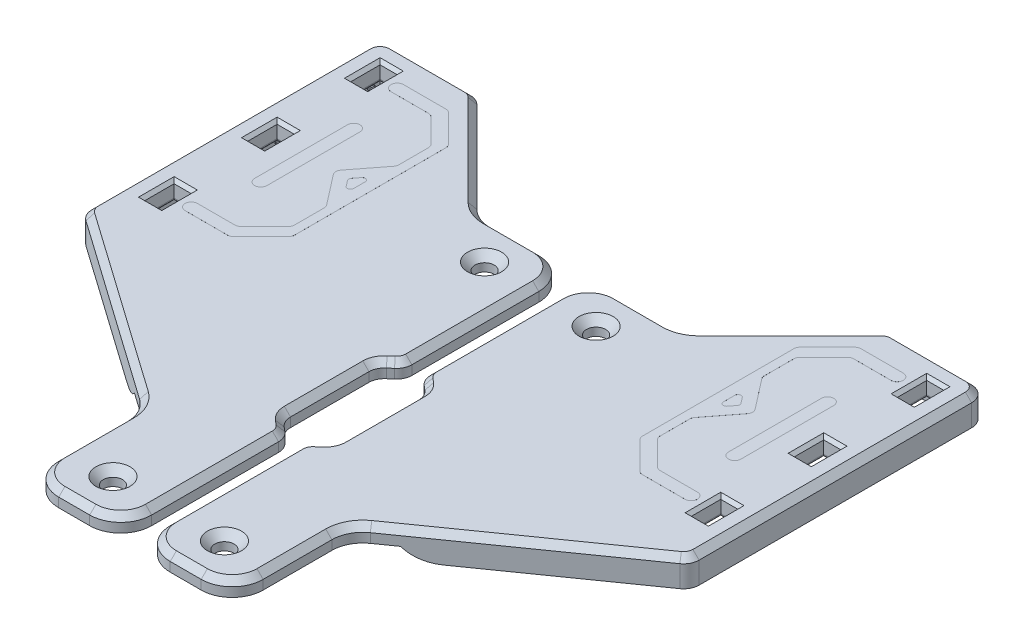
from build123d import *

# Parameters (mm, degrees)
SKETCH_1_R                  = 3.0999999999999996
SKETCH_1_R_2                = 3.099999999999995
EXTRUDE_1_DEPTH             = 6
EXTRUDE_START               = -3
SKETCH_1_3_R                = 3.0999999999999996
SKETCH_1_3_R_2              = 3.099999999999995
EXTRUDE_2_DEPTH             = 3
CUT_EXTRUDE_1_REACH         = 135.137
CUT_EXTRUDE_2_DEPTH         = 3
CHAMFER_2_SIZE              = 1
SKETCH_10_W                 = 2
SKETCH_10_H                 = 0.5
SKETCH_10_H_2               = 0.4999999999999998
SKETCH_10_H_3               = 0.5000000000000002
SKETCH_10_W_2               = 2.000000000000014
EXTRUDE_3_DEPTH             = 0.4
CUT_EXTRUDE_4_DEPTH         = 3.5
CHAMFER_4_SIZE              = 2
EXTRUDE_6_DEPTH             = 0.45
EXTRUDE_START_2             = 0.45
EXTRUDE_7_DEPTH             = 0.45
CUT_EXTRUDE_3_DEPTH         = 0.45
FILLET_5_R                  = 2
FILLET_6_R                  = 1
EXTRUDE_5_DEPTH             = 0.45
FILLET_4_R                  = 1
HOLE_WIZARD_M5_1_AT_2_COUNT = 2
HOLE_WIZARD_M5_1_AT_2_PITCH = 120
CUT_EXTRUDE_5_DEPTH         = 4
FILLET_7_R                  = 10
FILLET_8_R                  = 5
FILLET_9_R                  = 10
CHAMFER_1_SIZE              = 2
FILLET_10_R                 = 2


# Some blends are built 0.0001 mm under size
with BuildPart() as part:
    # 草图1 → 凸台-拉伸1 (new body)
    with BuildSketch(Plane(origin=(0, 0, 0), x_dir=(1, 0, 0), z_dir=(0, 1, 0))):
        Polygon((-15, 72.50000000000001), (15, 72.50000000000001), (14.999999999999998, 19.19549815588643), (9.999999999999996, 15), (9.999999999999996, -15), (15.00000000000001, -19.195498155886444), (15.00000000000001, -72.49999999999999), (-15.00000000000001, -72.49999999999999), (-15.00000000000001, -35.127517333903064), (-79.99999999999999, 10.658211067852571), (-79.99999999999999, 106.25214046456998), (-48.752140464569884, 106.25214046456998), align=None)
        with Locations(Location((0, 60, 0), (0, 0, 270))):
            Circle(SKETCH_1_R, mode=Mode.SUBTRACT)
        with Locations(Location((0, -60.000000000000014, 0), (0, 0, 90))):
            Circle(SKETCH_1_R_2, mode=Mode.SUBTRACT)
    extrude(amount=EXTRUDE_1_DEPTH)

    # 草图1<3> → 凸台-拉伸2 (add)
    with BuildSketch(Plane(origin=(0, 0, 0), x_dir=(1, 0, 0), z_dir=(0, 1, 0)).offset(EXTRUDE_START)):
        Polygon((-15, 72.50000000000001), (15, 72.50000000000001), (14.999999999999998, 19.19549815588643), (9.999999999999996, 15), (9.999999999999996, -15), (15.00000000000001, -19.195498155886444), (15.00000000000001, -72.49999999999999), (-15.00000000000001, -72.49999999999999), (-15.00000000000001, -35.127517333903064), (-79.99999999999999, 10.658211067852571), (-79.99999999999999, 106.25214046456998), (-48.752140464569884, 106.25214046456998), align=None)
        with Locations(Location((0, 60, 0), (0, 0, 270))):
            Circle(SKETCH_1_3_R, mode=Mode.SUBTRACT)
        with Locations(Location((0, -60.000000000000014, 0), (0, 0, 90))):
            Circle(SKETCH_1_3_R_2, mode=Mode.SUBTRACT)
        Polygon((-74.99999999999999, 101.25214046456999), (-74.99999999999997, 21.252140464570747), (-54.99999999999998, 21.252140464570747), (-40.568649385333515, 21.252140464570754), (-14.98918227169708, -10), (7.000000000000009, -10), (7.000000000000009, 10), (-5.513837031563742, 10), (-54.999999999999986, 70.46054475144805), (-54.999999999999986, 101.25214046456998), align=None, mode=Mode.SUBTRACT)
        Polygon((-74.99999999999999, 13.252140464570665), (-74.99999999999999, 18.252140464570754), (-41.989951171353525, 18.25214046457075), (-30.46851929688207, 4.175638960674685), (-44.32426895777747, -8.355716305037062), align=None, mode=Mode.SUBTRACT)
        Polygon((-16.410484057717092, -13.000000000000002), (5.0000000000000115, -13.000000000000002), (5.00000000000001, -17.33153829077498), (10.000000000000014, -21.52703644666142), (10.000000000000012, -47.49999999999998), (-10.00000000000001, -47.49999999999998), (-10.000000000000009, -32.53358793718488), (-40.97193002595808, -10.71708984108189), (-27.931915932188392, 1.0765015038959864), align=None, mode=Mode.SUBTRACT)
        Polygon((-51.99999999999998, 102.42893218813461), (-15.00000000000001, 65.42893218813452), (-15.000000000000009, 55.47875682148433), (-8.909070042553909, 48.0370615842724), (-23.197676350704, 36.34202470917039), (-51.99999999999998, 71.53174388490582), align=None, mode=Mode.SUBTRACT)
        Polygon((-0.28462332426223114, 37.49999999999999), (10.000000000000002, 37.49999999999999), (10.000000000000005, 21.527036446661413), (-0.1621263194904086, 13), (-4.092535245543746, 13.000000000000004), (-20.66415958985842, 33.24665836210991), (-6.3755532817083305, 44.94169523721192), align=None, mode=Mode.SUBTRACT)
    extrude(amount=EXTRUDE_2_DEPTH)

    # 草图7 → 切除-拉伸1 (cut, up to next)
    with BuildSketch(Plane.XZ, mode=Mode.PRIVATE) as cut_extrude_1_sk1:
        Polygon((-67.49999999999991, -99.25214046456998), (-72.99999999999994, -99.25214046456998), (-72.99999999999996, -89.75214046456999), (-67.49999999999999, -89.75214046456999), align=None)
    cut_extrude_1_tool1 = extrude(cut_extrude_1_sk1.sketch, amount=-CUT_EXTRUDE_1_REACH, mode=Mode.PRIVATE) & part.part
    # 草图7 → 切除-拉伸1 (cut, up to next)
    with BuildSketch(Plane.XZ, mode=Mode.PRIVATE) as cut_extrude_1_sk2:
        Polygon((-67.49999999999991, -66.00214046457037), (-67.49999999999999, -56.502140464570374), (-72.99999999999996, -56.502140464570374), (-72.99999999999994, -66.00214046457037), align=None)
    cut_extrude_1_tool2 = extrude(cut_extrude_1_sk2.sketch, amount=-CUT_EXTRUDE_1_REACH, mode=Mode.PRIVATE) & part.part
    # 草图7 → 切除-拉伸1 (cut, up to next)
    with BuildSketch(Plane.XZ, mode=Mode.PRIVATE) as cut_extrude_1_sk3:
        Polygon((-67.49999999999991, -32.75214046457076), (-67.49999999999999, -23.25214046457076), (-72.99999999999996, -23.25214046457076), (-72.99999999999994, -32.75214046457076), align=None)
    cut_extrude_1_tool3 = extrude(cut_extrude_1_sk3.sketch, amount=-CUT_EXTRUDE_1_REACH, mode=Mode.PRIVATE) & part.part
    # 草图7 → 切除-拉伸1 (cut, up to next)
    with BuildSketch(Plane.XZ, mode=Mode.PRIVATE) as cut_extrude_1_sk4:
        with BuildLine():
            Line((-60.499999999999986, -76.25214046457036), (-60.49999999999999, -46.25214046457037))
            ThreePointArc((-60.49999999999999, -46.25214046457037), (-58.49999999999998, -44.25214046457037), (-56.499999999999986, -46.25214046457037))
            Line((-56.499999999999986, -46.25214046457037), (-56.49999999999998, -76.25214046457036))
            ThreePointArc((-56.49999999999998, -76.25214046457036), (-58.49999999999997, -78.25214046457039), (-60.499999999999986, -76.25214046457036))
        make_face()
    cut_extrude_1_tool4 = extrude(cut_extrude_1_sk4.sketch, amount=-CUT_EXTRUDE_1_REACH, mode=Mode.PRIVATE) & part.part
    add(cut_extrude_1_tool1.solids().sort_by_distance((-70.25, 0, -94.50214))[0], mode=Mode.SUBTRACT)
    add(cut_extrude_1_tool2.solids().sort_by_distance((-70.25, 0, -61.25214))[0], mode=Mode.SUBTRACT)
    add(cut_extrude_1_tool3.solids().sort_by_distance((-70.25, 0, -28.00214))[0], mode=Mode.SUBTRACT)
    add(cut_extrude_1_tool4.solids().sort_by_distance((-58.5, 0, -61.25214))[0], mode=Mode.SUBTRACT)

    # 草图9 → 切除-拉伸2 (cut)
    with BuildSketch(Plane.XZ.offset(3)):
        Polygon((-54.899999999999984, -101.35214046456997), (-54.899999999999984, -70.46054475144805), (-54.899999999999984, -21.152140464570753), (-75.09999999999998, -21.152140464570756), (-75.09999999999998, -101.35214046456997), align=None)
    extrude(amount=-CUT_EXTRUDE_2_DEPTH, mode=Mode.SUBTRACT)

    # 倒角2
    chamfer_2_edges = [part.edges().sort_by_distance(p)[0] for p in [
        (-70.24999999999993, 6, -99.25214046456998),
        (-72.99999999999994, 6, -94.50214046456998),
        (-70.24999999999997, 6, -89.75214046456998),
        (-67.49999999999996, 6, -94.50214046456998),
        (-72.99999999999994, 6, -61.252140464570374),
        (-70.24999999999997, 6, -56.502140464570374),
        (-67.49999999999994, 6, -61.252140464570374),
        (-70.24999999999993, 6, -66.00214046457037),
        (-72.99999999999993, 6, -28.002140464570758),
        (-70.24999999999997, 6, -23.25214046457076),
        (-67.49999999999994, 6, -28.002140464570758),
        (-70.24999999999993, 6, -32.75214046457076),
    ]]
    chamfer(chamfer_2_edges, length=CHAMFER_2_SIZE)

    # 草图10 → 凸台-拉伸3 (add)
    with BuildSketch(Plane(origin=(-75.09999999999998, 0, 0), x_dir=(0, 0, -1), z_dir=(1, 0, 0))):
        with Locations((98.35214046456997, -1.9000000000000004)):
            Rectangle(SKETCH_10_W, SKETCH_10_H)
        with Locations((88.35214046456997, -1.90000000000007)):
            Rectangle(SKETCH_10_W, SKETCH_10_H_2)
        with Locations((78.35214046456998, -1.9000000000001402)):
            Rectangle(SKETCH_10_W, SKETCH_10_H_3)
        with Locations((68.35214046456998, -1.90000000000021)):
            Rectangle(SKETCH_10_W, SKETCH_10_H)
        with Locations((58.35214046456999, -1.9000000000002797)):
            Rectangle(SKETCH_10_W, SKETCH_10_H)
        with Locations((48.35214046457, -1.9000000000003494)):
            Rectangle(SKETCH_10_W_2, SKETCH_10_H_2)
        with Locations((38.35214046457, -1.9000000000004196)):
            Rectangle(SKETCH_10_W, SKETCH_10_H_3)
        with Locations((28.352140464570006, -1.9000000000004893)):
            Rectangle(SKETCH_10_W, SKETCH_10_H_3)
    extrude(amount=EXTRUDE_3_DEPTH)

    # 草图14 → 切除-拉伸4 (cut)
    with BuildSketch(Plane.XZ):
        Polygon((-52.49999999999998, -67.40612806581757), (-52.49999999999998, -21.252140464570747), (-40.568649385333515, -21.252140464570754), (-14.989182271697075, 10), (7.000000000000009, 10), (7.000000000000009, -10), (-5.513837031563742, -10), align=None)
        Polygon((-4.092535245543746, -13.000000000000004), (-20.664159589858432, -33.246658362109926), (-6.375553281708333, -44.94169523721192), (-0.2846233242622259, -37.49999999999999), (10.000000000000002, -37.49999999999999), (10.000000000000005, -21.527036446661413), (-0.16212631949040576, -13), align=None)
        Polygon((-8.9090700425539, -48.037061584272394), (-23.197676350704, -36.34202470917039), (-51.99999999999997, -71.53174388490582), (-51.99999999999998, -102.42893218813461), (-15.00000000000002, -65.42893218813454), (-15.000000000000009, -55.47875682148433), align=None)
        Polygon((-10.000000000000009, 32.53358793718488), (-40.97193002595809, 10.717089841081894), (-27.931915932188392, -1.0765015038959898), (-16.410484057717092, 13.000000000000002), (5.0000000000000115, 13.000000000000002), (5.00000000000001, 17.33153829077498), (10.000000000000012, 21.527036446661423), (10.000000000000012, 47.49999999999998), (-10.00000000000001, 47.49999999999998), align=None)
        Polygon((-41.989951171353525, -18.25214046457075), (-30.468519296882068, -4.175638960674681), (-44.32426895777747, 8.355716305037062), (-74.99999999999999, -13.252140464570658), (-74.99999999999999, -18.252140464570754), align=None)
    extrude(amount=-CUT_EXTRUDE_4_DEPTH, mode=Mode.SUBTRACT)

    # 倒角4
    chamfer_4_edges = [part.edges().sort_by_distance(p)[0] for p in [
        (-52.49999999999998, 0, -44.329134265194156),
    ]]
    chamfer(chamfer_4_edges, length=CHAMFER_4_SIZE)

    # 草图16 → 凸台-拉伸7 (add)
    with BuildSketch(Plane(origin=(0, 5.55, 0), x_dir=(-1, 0, 0), z_dir=(0, -1, 0)).offset(EXTRUDE_START_2)):
        with BuildLine():
            Line((60.49999999999999, 46.25214046457037), (60.499999999999986, 76.25214046457036))
            ThreePointArc((60.499999999999986, 76.25214046457036), (58.49999999999997, 78.25214046457039), (56.49999999999998, 76.25214046457036))
            Line((56.49999999999998, 76.25214046457036), (56.49999999999997, 46.25214046457037))
            ThreePointArc((56.49999999999997, 46.25214046457037), (58.49999999999998, 44.25214046457035), (60.49999999999999, 46.25214046457037))
        make_face()
    extrude(amount=-EXTRUDE_7_DEPTH)

    # 草图12 → 切除-拉伸3 (cut)
    with BuildSketch(Plane(origin=(0, 6, 0), x_dir=(1, 0, 0), z_dir=(0, 1, 0))):
        Polygon((-63.2627201241457, 26.002140464570758), (-48.16157278891774, 26.002140464570758), (-38.18081064901795, 35.98290260447015), (-38.18081064901794, 56.170502177980715), (-38.18081064901795, 66.33377875116011), (-38.18081064901796, 86.52137832467069), (-48.161572788917766, 96.50214046456998), (-63.2627201241457, 96.50214046456998), (-66.50000000000006, 94.50214046456999), (-63.262720124145716, 92.50214046456996), (-49.818427038410064, 92.50214046456998), (-41.00923777376407, 83.69295119992442), (-41.00923777376406, 72.61881387415542), (-49.81842703841007, 61.25214046457037), (-41.00923777376407, 49.88546705498529), (-41.00923777376409, 38.811329729216396), (-49.81842703841007, 30.00214046457076), (-63.2627201241457, 30.00214046457076), (-66.50000000000004, 28.002140464570758), align=None)
        Polygon((-45.390370436523504, 61.25214046457037), (-41.68081064901796, 56.465621145803105), (-41.68081064901796, 66.03865978333762), align=None, mode=Mode.SUBTRACT)
    extrude(amount=-CUT_EXTRUDE_3_DEPTH, mode=Mode.SUBTRACT)

    # 圆角5
    fillet_5_edges = [part.edges().sort_by_distance(p)[0] for p in [
        (-38.18081064901796, 5.775, -86.52137832467069),
        (-48.161572788917766, 5.775, -96.50214046456998),
        (-63.2627201241457, 5.775, -96.50214046456998),
        (-66.50000000000006, 5.775, -94.50214046456999),
        (-63.262720124145716, 5.775, -92.50214046456996),
        (-49.818427038410064, 5.775, -92.50214046456998),
        (-38.18081064901795, 5.775, -35.98290260447015),
        (-48.16157278891774, 5.775, -26.002140464570758),
        (-49.81842703841007, 5.775, -30.00214046457076),
        (-63.2627201241457, 5.775, -26.002140464570758),
        (-63.2627201241457, 5.775, -30.00214046457076),
        (-66.50000000000004, 5.775, -28.002140464570758),
        (-41.00923777376407, 5.775, -83.69295119992442),
        (-41.00923777376406, 5.775, -72.61881387415542),
        (-41.00923777376407, 5.775, -49.88546705498529),
        (-41.00923777376409, 5.775, -38.811329729216396),
        (-49.81842703841007, 5.775, -61.25214046457037),
    ]]
    fillet(fillet_5_edges, radius=FILLET_5_R - 0.0001)  # a hair under: the kernel refuses the full size

    # 圆角6
    fillet_6_edges = [part.edges().sort_by_distance(p)[0] for p in [
        (-41.68081064901796, 5.775, -66.03865978333762),
        (-41.68081064901796, 5.775, -56.465621145803105),
        (-45.390370436523504, 5.775, -61.25214046457037),
    ]]
    fillet(fillet_6_edges, radius=FILLET_6_R)

    # 圆角4
    fillet_4_edges = [part.edges().sort_by_distance(p)[0] for p in [
        (-72.99999999999994, 0, -94.50214046456998),
        (-70.24999999999993, 0, -99.25214046456998),
        (-67.49999999999994, 0, -94.50214046456998),
        (-70.24999999999997, 0, -89.75214046456999),
        (-70.24999999999997, 0, -56.502140464570374),
        (-72.99999999999994, 0, -61.252140464570374),
        (-70.24999999999993, 0, -66.00214046457037),
        (-67.49999999999994, 0, -61.252140464570374),
        (-70.24999999999997, 0, -23.25214046457076),
        (-72.99999999999994, 0, -28.002140464570758),
        (-70.24999999999993, 0, -32.75214046457076),
        (-67.49999999999994, 0, -28.002140464570758),
    ]]
    fillet(fillet_4_edges, radius=FILLET_4_R)

    # 草图6 → M5 平头机械螺钉的锥形沉头孔1 (revolve, cut)
    with BuildSketch(Plane(origin=(0, 6, 60), x_dir=(0, 0, 1), z_dir=(1, 0, 0))):
        Polygon((0, 0), (0, 9.000000000000002), (2.9, 9.000000000000002), (2.899999999999998, 2.6), (5.5, 0), align=None)
    hole_wizard_m5_1 = revolve(axis=Axis((0, 12.34999999999999, 60), (0, -1, 0)), mode=Mode.SUBTRACT)

    # M5 平头机械螺钉的锥形沉头孔1 at 2: M5 平头机械螺钉的锥形沉头孔1 ×2
    with Locations(*[(0, 0, -i * HOLE_WIZARD_M5_1_AT_2_PITCH) for i in range(1, HOLE_WIZARD_M5_1_AT_2_COUNT)]):
        add(hole_wizard_m5_1, mode=Mode.SUBTRACT)

    # 草图17 → 切除-拉伸5 (cut)
    with BuildSketch(Plane.XZ.offset(3)):
        Polygon((14.99999999999999, -92.09074949007032), (15, 72.49999999999999), (-25.000000000000014, 72.49999999999999), (-25.000000000000014, -92.09074949007032), align=None)
    extrude(amount=-CUT_EXTRUDE_5_DEPTH, mode=Mode.SUBTRACT)

    # 圆角7
    # the kernel refuses this fillet: 10 mm, written as the material it takes off along each edge
    with BuildSketch(Plane(origin=(-25.000000000000014, -3, 48.083559118248345), x_dir=(-1, 0, 0), z_dir=(0, 0, -1))) as fillet_7_piece_1:
        with BuildLine():
            CenterArc((8, 10), FILLET_7_R, 216.86989764584402, 53.13010235415595)
            Line((0, 4), (0, 0))
            Line((0, 0), (8, 0))
        make_face()
    extrude(amount=46.1159085045455, mode=Mode.SUBTRACT)
    with BuildSketch(Plane(origin=(-25.000000000000014, -3, 22.505615673760843), x_dir=(-1, 0, 0), z_dir=(0, 0, -1))) as fillet_7_piece_2:
        with BuildLine():
            CenterArc((8, 10), FILLET_7_R, 216.86989764584402, 53.13010235415595)
            Line((0, 4), (0, 0))
            Line((0, 0), (8, 0))
        make_face()
    extrude(amount=44.73649915621429, mode=Mode.SUBTRACT)
    with BuildSketch(Plane(origin=(-25.000000000000014, -3, -13.80754452388247), x_dir=(-1, 0, 0), z_dir=(0, 0, -1))) as fillet_7_piece_3:
        with BuildLine():
            CenterArc((8, 10), FILLET_7_R, 216.86989764584402, 53.13010235415595)
            Line((0, 4), (0, 0))
            Line((0, 0), (8, 0))
        make_face()
    extrude(amount=44.73649915621431, mode=Mode.SUBTRACT)
    with BuildSketch(Plane(origin=(-25.000000000000014, -3, -55.42893218813448), x_dir=(-1, 0, 0), z_dir=(0, 0, -1))) as fillet_7_piece_4:
        with BuildLine():
            CenterArc((8, 10), FILLET_7_R, 216.86989764584402, 53.13010235415595)
            Line((0, 4), (0, 0))
            Line((0, 0), (8, 0))
        make_face()
    extrude(amount=47.07106781186553, mode=Mode.SUBTRACT)

    # 圆角8
    fillet_8_edges = [part.edges().sort_by_distance(p)[0] for p in [
        (-48.752140464569884, 1.5, -106.25214046456998),
        (-79.99999999999999, 1.5, -106.25214046456998),
        (-79.99999999999999, 1.5, -10.658211067852571),
        (15.00000000000001, 3.5, 19.195498155886444),
        (9.999999999999996, 3.5, 15),
        (9.999999999999996, 3.5, -15),
        (14.999999999999998, 3.5, -19.19549815588643),
    ]]
    fillet(fillet_8_edges, radius=FILLET_8_R)

    # 圆角9
    fillet_9_edges = [part.edges().sort_by_distance(p)[0] for p in [
        (-15, 3.5, -72.50000000000001),
        (-15.00000000000001, 3.5, 35.127517333903064),
        (-15.00000000000001, 3.5, 72.49999999999999),
        (15.00000000000001, 3.5, 72.49999999999999),
        (15, 3.5, -72.50000000000001),
    ]]
    fillet(fillet_9_edges, radius=FILLET_9_R)

    # 倒角1
    chamfer_1_edges = [part.edges().sort_by_distance(p)[0] for p in [
        (9.999999999999996, 6, 1.78e-15),
        (12.500000000000005, 6, 17.097749077943224),
        (12.499999999999998, 6, -17.097749077943217),
        (-62.91160413821767, 6, -106.25214046456998),
        (-32.60830327931856, 6, -90.10830327931862),
        (-79.99999999999999, 6, -57.25214046457037),
        (15.00000000000001, 6, 42.013518223330706),
        (14.531538935183251, 6, -19.413945137957924),
        (14.531538935183264, 6, 19.41394513795794),
        (-79.43828764633393, 6, -10.949619505187423),
        (-78.53553390593272, 6, -104.78767437050271),
        (-48.9097911146099, 6, -105.87153812712641),
        (10.468461064816744, 6, 14.781553017928507),
        (10.468461064816744, 6, -14.781553017928509),
        (-15.00000000000001, 6, 51.40768806366968),
        (-48.56032055367993, 6, 11.487767765493114),
        (-2.928932188134519, 6, -72.50000000000001),
        (14.999999999999998, 6, -42.01351822333071),
        (3.55e-15, 6, 72.49999999999999),
        (-12.071067811865488, 6, 69.57106781186546),
        (12.071067811865486, 6, 69.57106781186546),
        (12.071067811865476, 6, -69.57106781186549),
        (-16.12342470733215, 6, 35.710334208572725),
        (-14.684698699919942, 6, -73.26120467488714),
    ]]
    chamfer(chamfer_1_edges, length=CHAMFER_1_SIZE)

    # 圆角10
    fillet_10_edges = [part.edges().sort_by_distance(p)[0] for p in [
        (-4.092535245543746, 2.25, -13.000000000000004),
        (-0.16212631949040632, 2.25, -13),
        (10.000000000000005, 2.25, -21.527036446661413),
        (10.000000000000002, 2.25, -37.49999999999999),
        (-51.99999999999998, 0.25, -102.42893218813461),
        (-15.000000000000018, 2.25, -65.42893218813454),
        (-15.000000000000009, 2.25, -55.47875682148433),
        (-40.568649385333515, 0.25, -21.252140464570754),
        (-14.989182271697077, 2.25, 10),
        (7.000000000000009, 2.25, 10),
        (-5.513837031563742, 2.25, -10),
        (7.000000000000009, 2.25, -10),
        (-41.989951171353525, 0.25, -18.25214046457075),
        (-74.99999999999999, 0.25, -18.252140464570754),
        (-10.000000000000009, 2.25, 32.53358793718488),
        (-10.00000000000001, 2.25, 47.49999999999998),
        (10.000000000000012, 2.25, 47.49999999999998),
        (5.0000000000000115, 2.25, 13.000000000000002),
        (5.00000000000001, 2.25, 17.33153829077498),
        (10.000000000000012, 2.25, 21.527036446661423),
        (-54.89999999999999, -1.5, -70.33836808402283),
        (-0.2846233242622269, 2.25, -37.49999999999999),
        (-6.375553281708332, 2.25, -44.94169523721192),
        (-20.66415958985843, 2.25, -33.246658362109926),
        (-8.909070042553902, 2.25, -48.037061584272394),
        (-23.197676350704, 2.25, -36.34202470917039),
        (-51.99999999999997, 0.25, -71.53174388490582),
        (-16.410484057717092, 2.25, 13.000000000000002),
        (-27.931915932188392, 0.9397063939450092, -1.0765015038959884),
        (-40.97193002595809, 0.25, 10.717089841081892),
        (-30.468519296882068, 0.4128622758458289, -4.175638960674683),
        (-44.32426895777747, 0.25, 8.355716305037062),
        (-74.99999999999999, 0.25, -13.252140464570662),
    ]]
    fillet(fillet_10_edges, radius=FILLET_10_R)


with BuildPart() as body_2:
    # 草图15 → 凸台-拉伸6 (new body)
    with BuildSketch(Plane(origin=(0, 6, 0), x_dir=(1, 0, 0), z_dir=(0, 1, 0))):
        with BuildLine():
            Line((-60.499999999999986, 76.25214046457036), (-60.49999999999999, 46.25214046457037))
            ThreePointArc((-60.49999999999999, 46.25214046457037), (-58.49999999999998, 44.252140464570346), (-56.499999999999986, 46.25214046457037))
            Line((-56.499999999999986, 46.25214046457037), (-56.49999999999998, 76.25214046457036))
            ThreePointArc((-56.49999999999998, 76.25214046457036), (-58.49999999999997, 78.25214046457037), (-60.499999999999986, 76.25214046457036))
        make_face()
    extrude(amount=-EXTRUDE_6_DEPTH)


with BuildPart() as body_3:
    # 草图13 → 凸台-拉伸5 (new body)
    with BuildSketch(Plane(origin=(0, 5.56, 0), x_dir=(1, 0, 0), z_dir=(0, 1, 0))):
        with BuildLine():
            Line((-38.18081064901795, 36.81132972921637), (-38.18081064901794, 85.69295119992447))
            ThreePointArc((-38.18081064901794, 85.69295119992447), (-38.33305158399538, 86.45831806465468), (-38.766597086644886, 87.1071647622976))
            Line((-38.766597086644886, 87.1071647622976), (-47.57578635129086, 95.91635402694311))
            ThreePointArc((-47.57578635129086, 95.91635402694311), (-48.22463304893376, 96.34989952959256), (-48.98999991366392, 96.50214046456998))
            Line((-48.98999991366392, 96.50214046456998), (-62.6947429791654, 96.50214046456998))
            ThreePointArc((-62.6947429791654, 96.50214046456998), (-63.24111497306242, 96.42606292773864), (-63.74592033147014, 96.20361810885495))
            ThreePointArc((-63.74592033147014, 96.20361810885495), (-64.69474297916541, 94.50214046456996), (-63.74592033147014, 92.80066282028498))
            ThreePointArc((-63.74592033147014, 92.80066282028498), (-63.24111497306242, 92.57821800140131), (-62.6947429791654, 92.50214046456996))
            Line((-62.6947429791654, 92.50214046456996), (-50.64685416315622, 92.50214046456998))
            ThreePointArc((-50.64685416315622, 92.50214046456998), (-49.88148729842607, 92.34989952959256), (-49.23264060078317, 91.91635402694311))
            Line((-49.23264060078317, 91.91635402694311), (-41.595024211391014, 84.27873763755133))
            ThreePointArc((-41.595024211391014, 84.27873763755133), (-41.161478708741505, 83.6298909399084), (-41.00923777376407, 82.86452407517821))
            Line((-41.00923777376407, 82.86452407517821), (-41.00923777376406, 73.30309389016034))
            ThreePointArc((-41.00923777376406, 73.30309389016034), (-41.116929940844095, 72.65565967306199), (-41.42840883923381, 72.07794904984473))
            Line((-41.42840883923381, 72.07794904984473), (-48.868937914719424, 62.477285304885974))
            ThreePointArc((-48.868937914719424, 62.477285304885974), (-49.28810898018917, 61.252140464570374), (-48.86893791471944, 60.02699562425477))
            Line((-48.86893791471944, 60.02699562425477), (-41.428408839233825, 50.426331879295994))
            ThreePointArc((-41.428408839233825, 50.426331879295994), (-41.1169299408441, 49.84862125607874), (-41.00923777376407, 49.201187038980386))
            Line((-41.00923777376407, 49.201187038980386), (-41.00923777376409, 39.63975685396261))
            ThreePointArc((-41.00923777376409, 39.63975685396261), (-41.16147870874151, 38.87438998923241), (-41.595024211391014, 38.22554329158949))
            Line((-41.595024211391014, 38.22554329158949), (-49.23264060078318, 30.587926902197637))
            ThreePointArc((-49.23264060078318, 30.587926902197637), (-49.88148729842608, 30.15438139954818), (-50.64685416315624, 30.00214046457076))
            Line((-50.64685416315624, 30.00214046457076), (-62.69474297916538, 30.00214046457076))
            ThreePointArc((-62.69474297916538, 30.00214046457076), (-63.24111497306241, 29.926062927739427), (-63.745920331470124, 29.703618108855746))
            ThreePointArc((-63.745920331470124, 29.703618108855746), (-64.69474297916538, 28.002140464570758), (-63.745920331470124, 26.300662820285773))
            ThreePointArc((-63.745920331470124, 26.300662820285773), (-63.24111497306241, 26.078218001402096), (-62.69474297916538, 26.002140464570758))
            Line((-62.69474297916538, 26.002140464570758), (-48.98999991366391, 26.002140464570758))
            ThreePointArc((-48.98999991366391, 26.002140464570758), (-48.22463304893375, 26.15438139954818), (-47.57578635129084, 26.587926902197633))
            Line((-47.57578635129084, 26.587926902197633), (-38.76659708664488, 35.39711616684324))
            ThreePointArc((-38.76659708664488, 35.39711616684324), (-38.33305158399538, 36.04596286448617), (-38.18081064901795, 36.81132972921637))
        make_face()
        with BuildLine():
            Line((-43.47122511628308, 63.72845212338031), (-44.91562587467818, 61.86471288472817))
            ThreePointArc((-44.91562587467818, 61.86471288472817), (-45.125211407413055, 61.25214046457037), (-44.91562587467818, 60.63956804441256))
            Line((-44.91562587467818, 60.63956804441256), (-43.47122511628308, 58.77582880576041))
            ThreePointArc((-43.47122511628308, 58.77582880576041), (-42.35709354046878, 58.44224730945824), (-41.68081064901796, 59.388401225918216))
            Line((-41.68081064901796, 59.388401225918216), (-41.68081064901796, 63.11587970322251))
            ThreePointArc((-41.68081064901796, 63.11587970322251), (-42.35709354046878, 64.0620336196825), (-43.47122511628308, 63.72845212338031))
        make_face(mode=Mode.SUBTRACT)
    extrude(amount=EXTRUDE_5_DEPTH)


with BuildPart() as body_4:
    # 镜向3: mirrored copy
    add(part.part.mirror(Plane(origin=(18, 0, 0), x_dir=(0, 0, 1), z_dir=(1, 0, 0))))


with BuildPart() as body_5:
    # Mirror 3 2: mirrored copy
    add(body_2.part.mirror(Plane(origin=(18, 0, 0), x_dir=(0, 0, 1), z_dir=(1, 0, 0))))


with BuildPart() as body_6:
    # Mirror 3 3: mirrored copy
    add(body_3.part.mirror(Plane(origin=(18, 0, 0), x_dir=(0, 0, 1), z_dir=(1, 0, 0))))


solid = Compound([part.part, body_2.part, body_3.part, body_4.part, body_5.part, body_6.part])
